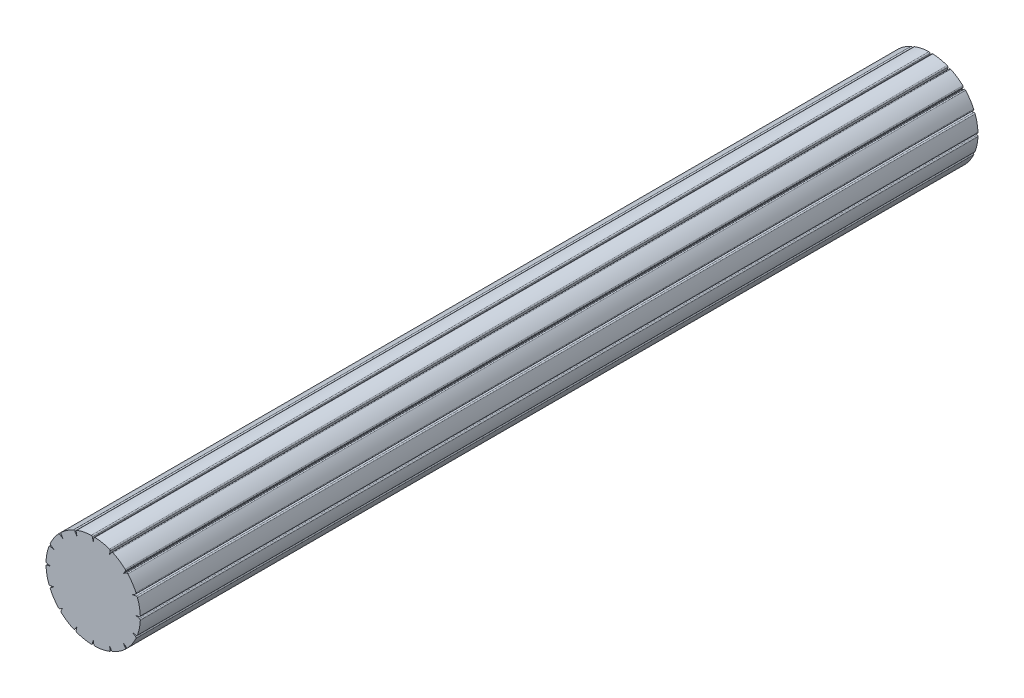
from build123d import *

# Parameters (mm, degrees)
CROQUIS2_R              = 4
CROQUIS2_R_2            = 2.05
SALIENTE_EXTRUIR1_DEPTH = 4
CROQUIS3_R              = 4
SALIENTE_EXTRUIR4_DEPTH = 65
CROQUIS4_R              = 4
SALIENTE_EXTRUIR5_DEPTH = 2
REDONDEO1_R             = 0.1
REDONDEO2_R             = 0.2
CORTAR_EXTRUIR1_REACH   = 73.225
REDONDEO3_R             = 0.1
MATRIZC14_DEPTH         = 71
CHAFL_N1_SIZE           = 0.5


# Read off the part's stored shape, not the designer's step: MatrizC14
with BuildPart() as part:
    # Croquis2 → Saliente-Extruir1 (new body)
    with BuildSketch(Plane.XY):
        Circle(CROQUIS2_R)
        Circle(CROQUIS2_R_2, mode=Mode.SUBTRACT)
    extrude(amount=SALIENTE_EXTRUIR1_DEPTH)

    # Croquis3 → Saliente-Extruir4 (add)
    with BuildSketch(Plane.XY.offset(4)):
        Circle(CROQUIS3_R)
        with BuildLine():
            Line((-0.125, 3.797943522), (-0.125, 2.297943522))
            Line((-0.125, 2.297943522), (0.125, 2.297943522))
            Line((0.125, 2.297943522), (0.125, 3.797943522))
            ThreePointArc((0.125, 3.797943522), (0.741343224, 3.726984066), (1.337925122, 3.556677715))
            Line((1.337925122, 3.556677715), (0.763899973, 2.170858416))
            Line((0.763899973, 2.170858416), (0.994869856, 2.075187558))
            Line((0.994869856, 2.075187558), (1.568895005, 3.461006857))
            ThreePointArc((1.568895005, 3.461006857), (2.111166885, 3.159584527), (2.597163272, 2.773939967))
            Line((2.597163272, 2.773939967), (1.5365031, 1.713279795))
            Line((1.5365031, 1.713279795), (1.713279795, 1.5365031))
            Line((1.713279795, 1.5365031), (2.773939967, 2.597163272))
            ThreePointArc((2.773939967, 2.597163272), (3.159584527, 2.111166885), (3.461006857, 1.568895005))
            Line((3.461006857, 1.568895005), (2.075187558, 0.994869856))
            Line((2.075187558, 0.994869856), (2.170858416, 0.763899973))
            Line((2.170858416, 0.763899973), (3.556677715, 1.337925122))
            ThreePointArc((3.556677715, 1.337925122), (3.726984066, 0.741343224), (3.797943522, 0.125))
            Line((3.797943522, 0.125), (2.297943522, 0.125))
            Line((2.297943522, 0.125), (2.297943522, -0.125))
            Line((2.297943522, -0.125), (3.797943522, -0.125))
            ThreePointArc((3.797943522, -0.125), (3.726984066, -0.741343224), (3.556677715, -1.337925122))
            Line((3.556677715, -1.337925122), (2.170858416, -0.763899973))
            Line((2.170858416, -0.763899973), (2.075187558, -0.994869856))
            Line((2.075187558, -0.994869856), (3.461006857, -1.568895005))
            ThreePointArc((3.461006857, -1.568895005), (3.159584527, -2.111166885), (2.773939967, -2.597163272))
            Line((2.773939967, -2.597163272), (1.713279795, -1.5365031))
            Line((1.713279795, -1.5365031), (1.5365031, -1.713279795))
            Line((1.5365031, -1.713279795), (2.597163272, -2.773939967))
            ThreePointArc((2.597163272, -2.773939967), (2.111166885, -3.159584527), (1.568895005, -3.461006857))
            Line((1.568895005, -3.461006857), (0.994869856, -2.075187558))
            Line((0.994869856, -2.075187558), (0.763899973, -2.170858416))
            Line((0.763899973, -2.170858416), (1.337925122, -3.556677715))
            ThreePointArc((1.337925122, -3.556677715), (0.741343224, -3.726984066), (0.125, -3.797943522))
            Line((0.125, -3.797943522), (0.125, -2.297943522))
            Line((0.125, -2.297943522), (-0.125, -2.297943522))
            Line((-0.125, -2.297943522), (-0.125, -3.797943522))
            ThreePointArc((-0.125, -3.797943522), (-0.741343224, -3.726984066), (-1.337925122, -3.556677715))
            Line((-1.337925122, -3.556677715), (-0.763899973, -2.170858416))
            Line((-0.763899973, -2.170858416), (-0.994869856, -2.075187558))
            Line((-0.994869856, -2.075187558), (-1.568895005, -3.461006857))
            ThreePointArc((-1.568895005, -3.461006857), (-2.111166885, -3.159584527), (-2.597163272, -2.773939967))
            Line((-2.597163272, -2.773939967), (-1.5365031, -1.713279795))
            Line((-1.5365031, -1.713279795), (-1.713279795, -1.5365031))
            Line((-1.713279795, -1.5365031), (-2.773939967, -2.597163272))
            ThreePointArc((-2.773939967, -2.597163272), (-3.159584527, -2.111166885), (-3.461006857, -1.568895005))
            Line((-3.461006857, -1.568895005), (-2.075187558, -0.994869856))
            Line((-2.075187558, -0.994869856), (-2.170858416, -0.763899973))
            Line((-2.170858416, -0.763899973), (-3.556677715, -1.337925122))
            ThreePointArc((-3.556677715, -1.337925122), (-3.726984066, -0.741343224), (-3.797943522, -0.125))
            Line((-3.797943522, -0.125), (-2.297943522, -0.125))
            Line((-2.297943522, -0.125), (-2.297943522, 0.125))
            Line((-2.297943522, 0.125), (-3.797943522, 0.125))
            ThreePointArc((-3.797943522, 0.125), (-3.726984066, 0.741343224), (-3.556677715, 1.337925122))
            Line((-3.556677715, 1.337925122), (-2.170858416, 0.763899973))
            Line((-2.170858416, 0.763899973), (-2.075187558, 0.994869856))
            Line((-2.075187558, 0.994869856), (-3.461006857, 1.568895005))
            ThreePointArc((-3.461006857, 1.568895005), (-3.159584527, 2.111166885), (-2.773939967, 2.597163272))
            Line((-2.773939967, 2.597163272), (-1.713279795, 1.5365031))
            Line((-1.713279795, 1.5365031), (-1.5365031, 1.713279795))
            Line((-1.5365031, 1.713279795), (-2.597163272, 2.773939967))
            ThreePointArc((-2.597163272, 2.773939967), (-2.111166885, 3.159584527), (-1.568895005, 3.461006857))
            Line((-1.568895005, 3.461006857), (-0.994869856, 2.075187558))
            Line((-0.994869856, 2.075187558), (-0.763899973, 2.170858416))
            Line((-0.763899973, 2.170858416), (-1.337925122, 3.556677715))
            ThreePointArc((-1.337925122, 3.556677715), (-0.741343224, 3.726984066), (-0.125, 3.797943522))
        make_face(mode=Mode.SUBTRACT)
    extrude(amount=SALIENTE_EXTRUIR4_DEPTH)

    # Croquis4 → Saliente-Extruir5 (add)
    with BuildSketch(Plane.XY.offset(69)):
        Circle(CROQUIS4_R)
    extrude(amount=SALIENTE_EXTRUIR5_DEPTH)

    # Redondeo1
    redondeo1_edges = [part.edges().sort_by_distance(p)[0] for p in [
        (-2.111166885, -3.159584527, 4),
        (-1.28188243, -2.768097208, 4),
        (-0.879384915, -2.123022987, 4),
        (-1.050912547, -2.863768066, 4),
        (-0.741343224, -3.726984066, 4),
        (-0.125, -3.047943522, 4),
        (0, -2.297943522, 4),
        (0.125, -3.047943522, 4),
        (0.741343224, -3.726984066, 4),
        (1.050912547, -2.863768066, 4),
        (0.879384915, -2.123022987, 4),
        (1.28188243, -2.768097208, 4),
        (2.111166885, -3.159584527, 4),
        (2.066833186, -2.243609881, 4),
        (1.624891448, -1.624891448, 4),
        (2.243609881, -2.066833186, 4),
        (3.159584527, -2.111166885, 4),
        (2.768097208, -1.28188243, 4),
        (2.123022987, -0.879384915, 4),
        (2.863768066, -1.050912547, 4),
        (3.726984066, -0.741343224, 4),
        (3.047943522, -0.125, 4),
        (2.297943522, 0, 4),
        (3.047943522, 0.125, 4),
        (3.726984066, 0.741343224, 4),
        (2.863768066, 1.050912547, 4),
        (2.123022987, 0.879384915, 4),
        (2.768097208, 1.28188243, 4),
        (3.159584527, 2.111166885, 4),
        (2.243609881, 2.066833186, 4),
        (1.624891448, 1.624891448, 4),
        (2.066833186, 2.243609881, 4),
        (2.111166885, 3.159584527, 4),
        (1.28188243, 2.768097208, 4),
        (0.879384915, 2.123022987, 4),
        (1.050912547, 2.863768066, 4),
        (0.741343224, 3.726984066, 4),
        (0.125, 3.047943522, 4),
        (0, 2.297943522, 4),
        (-0.125, 3.047943522, 4),
        (-0.741343224, 3.726984066, 4),
        (-1.050912547, 2.863768066, 4),
        (-0.879384915, 2.123022987, 4),
        (-1.28188243, 2.768097208, 4),
        (-2.111166885, 3.159584527, 4),
        (-2.066833186, 2.243609881, 4),
        (-1.624891448, 1.624891448, 4),
        (-2.243609881, 2.066833186, 4),
        (-3.159584527, 2.111166885, 4),
        (-2.768097208, 1.28188243, 4),
        (-2.123022987, 0.879384915, 4),
        (-2.863768066, 1.050912547, 4),
        (-3.726984066, 0.741343224, 4),
        (-3.047943522, 0.125, 4),
        (-2.297943522, 0, 4),
        (-3.047943522, -0.125, 4),
        (-3.726984066, -0.741343224, 4),
        (-2.863768066, -1.050912547, 4),
        (-2.123022987, -0.879384915, 4),
        (-2.768097208, -1.28188243, 4),
        (-2.05, 0, 4),
        (-3.159584527, -2.111166885, 4),
        (-2.243609881, -2.066833186, 4),
        (-1.624891448, -1.624891448, 4),
        (-2.066833186, -2.243609881, 4),
    ]]
    fillet(redondeo1_edges, radius=REDONDEO1_R)

    # Redondeo2
    redondeo2_edges = [part.edges().sort_by_distance(p)[0] for p in [
        (-2.111166885, -3.159584527, 69),
        (-1.28188243, -2.768097208, 69),
        (-0.879384915, -2.123022987, 69),
        (-1.050912547, -2.863768066, 69),
        (-0.741343224, -3.726984066, 69),
        (-0.125, -3.047943522, 69),
        (0, -2.297943522, 69),
        (0.125, -3.047943522, 69),
        (0.741343224, -3.726984066, 69),
        (1.050912547, -2.863768066, 69),
        (0.879384915, -2.123022987, 69),
        (1.28188243, -2.768097208, 69),
        (2.111166885, -3.159584527, 69),
        (2.066833186, -2.243609881, 69),
        (1.624891448, -1.624891448, 69),
        (2.243609881, -2.066833186, 69),
        (3.159584527, -2.111166885, 69),
        (2.768097208, -1.28188243, 69),
        (2.123022987, -0.879384915, 69),
        (2.863768066, -1.050912547, 69),
        (3.726984066, -0.741343224, 69),
        (3.047943522, -0.125, 69),
        (2.297943522, 0, 69),
        (3.047943522, 0.125, 69),
        (3.726984066, 0.741343224, 69),
        (2.863768066, 1.050912547, 69),
        (2.123022987, 0.879384915, 69),
        (2.768097208, 1.28188243, 69),
        (3.159584527, 2.111166885, 69),
        (2.243609881, 2.066833186, 69),
        (1.624891448, 1.624891448, 69),
        (2.066833186, 2.243609881, 69),
        (2.111166885, 3.159584527, 69),
        (1.28188243, 2.768097208, 69),
        (0.879384915, 2.123022987, 69),
        (1.050912547, 2.863768066, 69),
        (0.741343224, 3.726984066, 69),
        (0.125, 3.047943522, 69),
        (0, 2.297943522, 69),
        (-0.125, 3.047943522, 69),
        (-0.741343224, 3.726984066, 69),
        (-1.050912547, 2.863768066, 69),
        (-0.879384915, 2.123022987, 69),
        (-1.28188243, 2.768097208, 69),
        (-2.111166885, 3.159584527, 69),
        (-2.066833186, 2.243609881, 69),
        (-1.624891448, 1.624891448, 69),
        (-2.243609881, 2.066833186, 69),
        (-3.159584527, 2.111166885, 69),
        (-2.768097208, 1.28188243, 69),
        (-2.123022987, 0.879384915, 69),
        (-2.863768066, 1.050912547, 69),
        (-3.726984066, 0.741343224, 69),
        (-3.047943522, 0.125, 69),
        (-2.297943522, 0, 69),
        (-3.047943522, -0.125, 69),
        (-3.726984066, -0.741343224, 69),
        (-2.863768066, -1.050912547, 69),
        (-2.123022987, -0.879384915, 69),
        (-2.768097208, -1.28188243, 69),
        (-3.159584527, -2.111166885, 69),
        (-2.243609881, -2.066833186, 69),
        (-1.624891448, -1.624891448, 69),
        (-2.066833186, -2.243609881, 69),
    ]]
    fillet(redondeo2_edges, radius=REDONDEO2_R)

    # Croquis5 → Cortar-Extruir1 (cut, up to next)
    with BuildSketch(Plane.XY.offset(71), mode=Mode.PRIVATE) as cortar_extruir1_sk1:
        Polygon((-0.143881887, 4.340208142), (0, 3.6), (0.143881887, 4.340208142), align=None)
    cortar_extruir1_tool1 = extrude(cortar_extruir1_sk1.sketch, amount=-CORTAR_EXTRUIR1_REACH, mode=Mode.PRIVATE) & part.part
    add(cortar_extruir1_tool1.solids().sort_by_distance((0, 4.093472, 71))[0], mode=Mode.SUBTRACT)

    # Redondeo3
    redondeo3_edges = [part.edges().sort_by_distance(p)[0] for p in [
        (0.077605774, 3.999247097, 35.5),
        (-0.077605774, 3.999247097, 35.5),
    ]]
    fillet(redondeo3_edges, radius=REDONDEO3_R)

    # MatrizC14 outline → MatrizC14 (cut)
    with BuildSketch(Plane.XY):
        with BuildLine():
            Line((-1.55610293, 3.593847056), (-1.378664353, 3.32576661))
            Line((-1.378664353, 3.32576661), (-1.442774396, 3.640877538))
            ThreePointArc((-1.442774396, 3.640877538), (-1.432104156, 3.709546541), (-1.379263514, 3.754681366))
            ThreePointArc((-1.379263514, 3.754681366), (-1.531678316, 3.695126728), (-1.681529756, 3.629388059))
            ThreePointArc((-1.681529756, 3.629388059), (-1.612228839, 3.634865345), (-1.55610293, 3.593847056))
        make_face()
        with BuildLine():
            ThreePointArc((1.55610293, 3.593847056), (1.612228839, 3.634865345), (1.681529756, 3.629388059))
            ThreePointArc((1.681529756, 3.629388059), (1.531678316, 3.695126728), (1.379263514, 3.754681366))
            ThreePointArc((1.379263514, 3.754681366), (1.432104156, 3.709546541), (1.442774396, 3.640877538))
            Line((1.442774396, 3.640877538), (1.378664353, 3.32576661))
            Line((1.378664353, 3.32576661), (1.55610293, 3.593847056))
        make_face()
        with BuildLine():
            ThreePointArc((2.81345544, 2.724245965), (2.881015402, 2.740662371), (2.942948441, 2.709068931))
            ThreePointArc((2.942948441, 2.709068931), (2.829762733, 2.827090886), (2.71184775, 2.940388032))
            ThreePointArc((2.71184775, 2.940388032), (2.743377206, 2.878472091), (2.726955314, 2.810959041))
            Line((2.726955314, 2.810959041), (2.547439557, 2.544815986))
            Line((2.547439557, 2.544815986), (2.81345544, 2.724245965))
        make_face()
        with BuildLine():
            ThreePointArc((3.641955473, 1.439836363), (3.710659507, 1.429146563), (3.75578694, 1.376250146))
            ThreePointArc((3.75578694, 1.376250146), (3.696462073, 1.528452859), (3.630972176, 1.67810639))
            ThreePointArc((3.630972176, 1.67810639), (3.636396994, 1.608845695), (3.59539157, 1.552765148))
            Line((3.59539157, 1.552765148), (3.32839018, 1.376040783))
            Line((3.32839018, 1.376040783), (3.641955473, 1.439836363))
        make_face()
        with BuildLine():
            ThreePointArc((3.915729454, -0.063485189), (3.975112931, -0.099653217), (3.99656262, -0.165792725))
            ThreePointArc((3.99656262, -0.165792725), (3.999999108, -0.002671884), (3.996780543, 0.160453402))
            ThreePointArc((3.996780543, 0.160453402), (3.975283978, 0.094394979), (3.915941929, 0.058279349))
            Line((3.915941929, 0.058279349), (3.60262357, -0.00262357))
            Line((3.60262357, -0.00262357), (3.915729454, -0.063485189))
        make_face()
        with BuildLine():
            ThreePointArc((3.593532462, -1.556781772), (3.634553367, -1.61291691), (3.629065399, -1.682226005))
            ThreePointArc((3.629065399, -1.682226005), (3.694572765, -1.533014051), (3.753948198, -1.381257733))
            ThreePointArc((3.753948198, -1.381257733), (3.708808508, -1.434061459), (3.6401627, -1.44471876))
            Line((3.6401627, -1.44471876), (3.32839018, -1.381287924))
            Line((3.32839018, -1.381287924), (3.593532462, -1.556781772))
        make_face()
        with BuildLine():
            ThreePointArc((2.724772763, -2.812970417), (2.741190237, -2.880521261), (2.709609237, -2.942450982))
            ThreePointArc((2.709609237, -2.942450982), (2.827090849, -2.82976277), (2.939889992, -2.712387664))
            ThreePointArc((2.939889992, -2.712387664), (2.877977381, -2.743904686), (2.810473451, -2.727481729))
            Line((2.810473451, -2.727481729), (2.547439557, -2.550063127))
            Line((2.547439557, -2.550063127), (2.724772763, -2.812970417))
        make_face()
        with BuildLine():
            ThreePointArc((1.441781062, -3.641242282), (1.431104209, -3.70992313), (1.378244709, -3.755055462))
            ThreePointArc((1.378244709, -3.755055462), (1.529789009, -3.695909305), (1.678803043, -3.630650127))
            ThreePointArc((1.678803043, -3.630650127), (1.60953416, -3.636085616), (1.553444384, -3.595077572))
            Line((1.553444384, -3.595077572), (1.378664353, -3.33101375))
            Line((1.378664353, -3.33101375), (1.441781062, -3.641242282))
        make_face()
        with BuildLine():
            ThreePointArc((-0.060376474, -3.915857173), (-0.096513209, -3.975215915), (-0.1626043, -3.996693614))
            ThreePointArc((-0.1626043, -3.996693614), (0, -4), (0.1626043, -3.996693614))
            ThreePointArc((0.1626043, -3.996693614), (0.096513209, -3.975215915), (0.060376474, -3.915857173))
            Line((0.060376474, -3.915857173), (0, -3.605247141))
            Line((0, -3.605247141), (-0.060376474, -3.915857173))
        make_face()
        with BuildLine():
            ThreePointArc((-1.553444384, -3.595077572), (-1.60953416, -3.636085616), (-1.678803043, -3.630650127))
            ThreePointArc((-1.678803043, -3.630650127), (-1.529789009, -3.695909305), (-1.378244709, -3.755055462))
            ThreePointArc((-1.378244709, -3.755055462), (-1.431104209, -3.70992313), (-1.441781062, -3.641242282))
            Line((-1.441781062, -3.641242282), (-1.378664353, -3.33101375))
            Line((-1.378664353, -3.33101375), (-1.553444384, -3.595077572))
        make_face()
        with BuildLine():
            ThreePointArc((-2.810473451, -2.727481729), (-2.877977381, -2.743904686), (-2.939889992, -2.712387664))
            ThreePointArc((-2.939889992, -2.712387664), (-2.827090849, -2.82976277), (-2.709609237, -2.942450982))
            ThreePointArc((-2.709609237, -2.942450982), (-2.741190237, -2.880521261), (-2.724772763, -2.812970417))
            Line((-2.724772763, -2.812970417), (-2.547439557, -2.550063127))
            Line((-2.547439557, -2.550063127), (-2.810473451, -2.727481729))
        make_face()
        with BuildLine():
            ThreePointArc((-3.6401627, -1.44471876), (-3.708808508, -1.434061459), (-3.753948198, -1.381257733))
            ThreePointArc((-3.753948198, -1.381257733), (-3.694572765, -1.533014051), (-3.629065399, -1.682226005))
            ThreePointArc((-3.629065399, -1.682226005), (-3.634553367, -1.61291691), (-3.593532462, -1.556781772))
            Line((-3.593532462, -1.556781772), (-3.32839018, -1.381287924))
            Line((-3.32839018, -1.381287924), (-3.6401627, -1.44471876))
        make_face()
        with BuildLine():
            ThreePointArc((-3.915941929, 0.058279349), (-3.975283978, 0.094394979), (-3.996780543, 0.160453402))
            ThreePointArc((-3.996780543, 0.160453402), (-3.999999108, -0.002671884), (-3.99656262, -0.165792725))
            ThreePointArc((-3.99656262, -0.165792725), (-3.975112931, -0.099653217), (-3.915729454, -0.063485189))
            Line((-3.915729454, -0.063485189), (-3.60262357, -0.00262357))
            Line((-3.60262357, -0.00262357), (-3.915941929, 0.058279349))
        make_face()
        with BuildLine():
            ThreePointArc((-3.59539157, 1.552765148), (-3.636396994, 1.608845695), (-3.630972176, 1.67810639))
            ThreePointArc((-3.630972176, 1.67810639), (-3.696462073, 1.528452859), (-3.75578694, 1.376250146))
            ThreePointArc((-3.75578694, 1.376250146), (-3.710659507, 1.429146563), (-3.641955473, 1.439836363))
            Line((-3.641955473, 1.439836363), (-3.32839018, 1.376040783))
            Line((-3.32839018, 1.376040783), (-3.59539157, 1.552765148))
        make_face()
        with BuildLine():
            ThreePointArc((-2.726955314, 2.810959041), (-2.743377206, 2.878472091), (-2.71184775, 2.940388032))
            ThreePointArc((-2.71184775, 2.940388032), (-2.829762733, 2.827090886), (-2.942948441, 2.709068931))
            ThreePointArc((-2.942948441, 2.709068931), (-2.881015402, 2.740662371), (-2.81345544, 2.724245965))
            Line((-2.81345544, 2.724245965), (-2.547439557, 2.544815986))
            Line((-2.547439557, 2.544815986), (-2.726955314, 2.810959041))
        make_face()
    extrude(amount=MATRIZC14_DEPTH, mode=Mode.SUBTRACT)

    # Chaflán1
    chafl_n1_edges = [part.edges().sort_by_distance(p)[0] for p in [
        (-2.05, 0, 0),
    ]]
    chamfer(chafl_n1_edges, length=CHAFL_N1_SIZE)


solid = part.part
